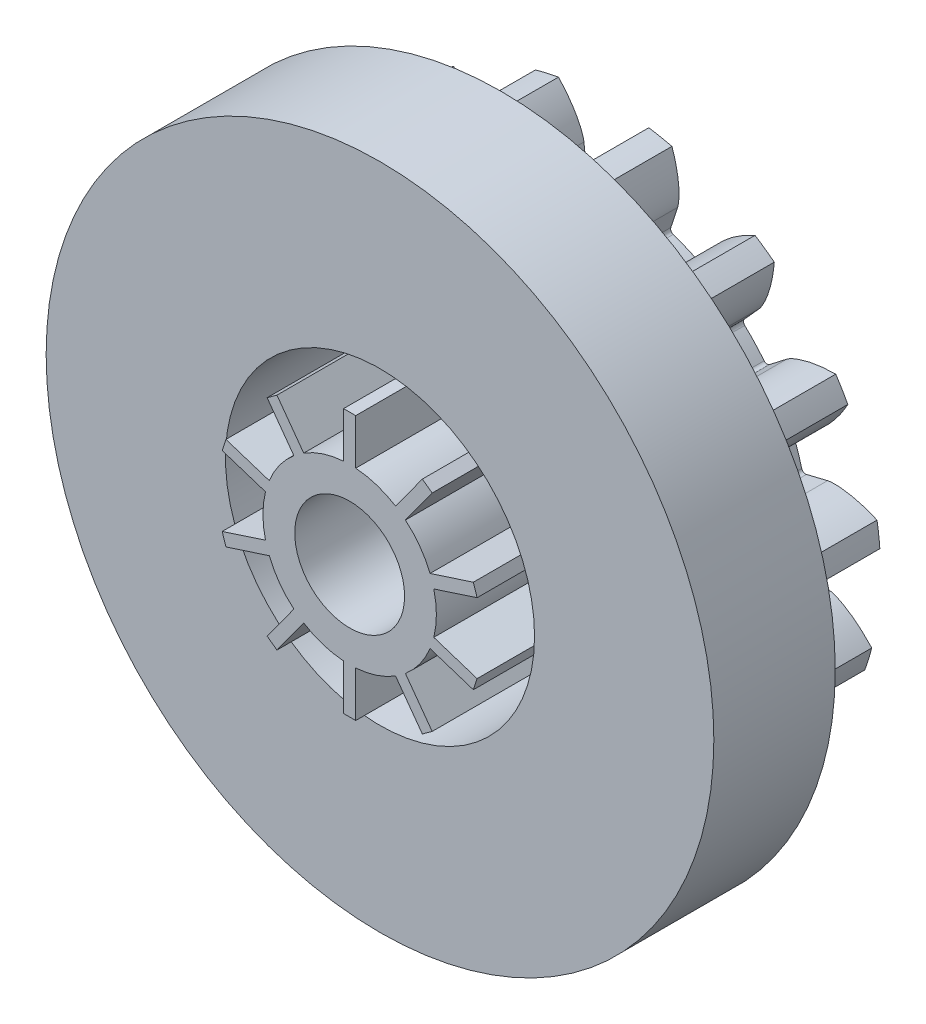
from build123d import *

# Parameters (mm, degrees)
SKETCH2_R                = 17.991666667
BOSS_EXTRUDE1_DEPTH      = 6
CUT_EXTRUDE1_DEPTH       = 6
FILLET1_R                = 0.254
CIRPATTERN3_COUNT        = 15
FILLET1_OF_CIRPATTERN3_R = 0.254
SKETCH3_R                = 17.991666667
BOSS_EXTRUDE2_DEPTH      = 1
SKETCH4_R                = 5.715
BOSS_EXTRUDE3_DEPTH      = 10
SKETCH5_R                = 3.6195
CUT_EXTRUDE2_DEPTH       = 31.60065603
SKETCH6_R                = 22
SKETCH6_R_2              = 10.184699829
BOSS_EXTRUDE4_DEPTH      = 8


# Read off the part's stored shape, not the designer's step: Cut-Extrude1
with BuildPart() as part:
    # Sketch2 → Boss-Extrude1 (new body)
    with BuildSketch(Plane.XY):
        Circle(SKETCH2_R)
    extrude(amount=BOSS_EXTRUDE1_DEPTH)

    # Cut-Extrude1 outline → Cut-Extrude1 (cut)
    with BuildSketch(Plane.XY):
        with BuildLine():
            add(Edge.make_bspline(
                [(17.405034837, -4.556844496), (17.338691355, -4.484278089), (17.194474578, -4.330614884), (16.972868305, -4.108341926), (16.699138419, -3.85718655), (16.447497308, -3.646349309), (16.232246792, -3.478953129), (16.05080163, -3.34681907), (15.864998696, -3.220553081), (15.674853543, -3.101130253), (15.480329647, -2.989260392), (15.29771766, -2.894691875), (15.128328526, -2.816354233), (14.98193445, -2.756834383), (14.866981202, -2.715793616), (14.775463249, -2.688070145), (14.718749461, -2.673483715), (14.688445491, -2.667246468), (14.677591871, -2.66527558)],
                knots=[0.499447972, 0.499447972, 0.499447972, 0.499447972, 0.499447972, 0.547323565, 0.602055884, 0.652783571, 0.680149903, 0.707515961, 0.734882063, 0.762248421, 0.789614741, 0.816980391, 0.844236067, 0.862480777, 0.880559096, 0.894007228, 0.903714168, 0.909090916, 0.909090916, 0.909090916, 0.909090916, 0.909090916], degree=4))
            ThreePointArc((17.405034837, -4.556844496), (17.91914784, -1.613756535), (17.9391376, 1.373831009))
            add(Edge.make_bspline(
                [(14.917620355, 0), (14.928651469, 0), (14.959582225, 0.000722592), (15.017989576, 0.004941481), (15.11298823, 0.015867702), (15.23342445, 0.035709845), (15.388097196, 0.068116321), (15.568757108, 0.114929364), (15.765327023, 0.175349646), (15.97670835, 0.250664633), (16.185130848, 0.334193391), (16.390503636, 0.425231009), (16.592637197, 0.522820865), (16.834332325, 0.64906559), (17.119593967, 0.811550625), (17.433792461, 1.009758546), (17.69154571, 1.188861507), (17.860896432, 1.314285557), (17.9391376, 1.373831009)],
                knots=[0, 0, 0, 0, 0, 0.005376748, 0.015083688, 0.02853182, 0.046610139, 0.064854849, 0.092110525, 0.119476175, 0.146842495, 0.174208853, 0.201574955, 0.228941013, 0.256307345, 0.307035032, 0.361767351, 0.409642944, 0.409642944, 0.409642944, 0.409642944, 0.409642944], degree=4))
            Line((14.917620355, 0), (13.229166667, 0))
            ThreePointArc((13.229166667, 0), (13.175844, -1.186585688), (13.016305852, -2.363605858))
            Line((13.016305852, -2.363605858), (14.677591871, -2.66527558))
        make_face()
    cut_extrude1 = extrude(amount=CUT_EXTRUDE1_DEPTH, mode=Mode.SUBTRACT)

    # Fillet1
    fillet1_edges = [part.edges().sort_by_distance(p)[0] for p in [
        (13.016305852, -2.363605858, 3),
        (13.229166667, 0, 3),
    ]]
    fillet(fillet1_edges, radius=FILLET1_R)

    # CirPattern3: Cut-Extrude1 ×15 about axis
    cirpattern3_axis = Axis((0, 0, 55), (0, 0, -1))
    for i in range(1, CIRPATTERN3_COUNT):
        add(cut_extrude1.rotate(cirpattern3_axis, i * 360 / CIRPATTERN3_COUNT), mode=Mode.SUBTRACT)

    # Fillet1 of CirPattern3
    fillet1_of_cirpattern3_edges = [part.edges().sort_by_distance(p)[0] for p in [
        (10.929621974, -7.453469943, 3),
        (12.085445117, -5.380786841, 3),
        (6.953107164, -11.254561362, 3),
        (8.852040314, -9.831186754, 3),
        (1.774336959, -13.109636877, 3),
        (4.088037322, -12.581685164, 3),
        (-3.711232226, -12.697937079, 3),
        (-1.382824462, -13.156695908, 3),
        (-8.555095644, -10.090648602, 3),
        (-6.614583333, -11.456794405, 3),
        (-11.919705304, -5.738595312, 3),
        (-10.702620655, -7.775909067, 3),
        (-13.22328963, -0.394286759, 3),
        (-12.940077635, -2.75049841, 3),
        (-12.240447049, 5.018197557, 3),
        (-12.940077635, 2.75049841, 3),
        (-9.141119973, 9.562989926, 3),
        (-10.702620655, 7.775909067, 3),
        (-4.461210208, 12.45425446, 3),
        (-6.614583334, 11.456794405, 3),
        (0.99008333, 13.192065255, 3),
        (-1.382824462, 13.156695908, 3),
        (6.270182465, 11.648848121, 3),
        (4.088037322, 12.581685164, 3),
        (10.46611009, 8.09143932, 3),
        (8.852040314, 9.831186754, 3),
        (12.852352199, 3.134947152, 3),
        (12.085445117, 5.380786841, 3),
    ]]
    fillet(fillet1_of_cirpattern3_edges, radius=FILLET1_OF_CIRPATTERN3_R)

    # Sketch3 → Boss-Extrude2 (add)
    with BuildSketch(Plane.XY.offset(6)):
        with Locations(Location((0, 0, 0), (0, 0, 177.328588329))):
            Circle(SKETCH3_R)
    extrude(amount=BOSS_EXTRUDE2_DEPTH)

    # Sketch4 → Boss-Extrude3 (add)
    with BuildSketch(Plane.XY.offset(7)):
        Circle(SKETCH4_R)
        with BuildLine():
            ThreePointArc((-3.674561448, 4.377079296), (-3.359192717, 4.623532123), (-3.027347853, 4.847307498))
            Line((-3.027347853, 4.847307498), (-4.790703609, 7.274358481))
            Line((-4.790703609, 7.274358481), (-5.437917205, 6.804130279))
            Line((-5.437917205, 6.804130279), (-3.674561448, 4.377079296))
        make_face()
        with BuildLine():
            ThreePointArc((-5.545565317, 1.381278508), (-5.435287991, 1.766032123), (-5.298351721, 2.142123721))
            Line((-5.298351721, 2.142123721), (-8.15152127, 3.069174705))
            Line((-8.15152127, 3.069174705), (-8.398734866, 2.308329492))
            Line((-8.398734866, 2.308329492), (-5.545565317, 1.381278508))
        make_face()
        with BuildLine():
            Line((0.4, 8.700984564), (-0.4, 8.700984564))
            Line((-0.4, 8.700984564), (-0.4, 5.700984564))
            ThreePointArc((-0.4, 5.700984564), (0, 5.715), (0.4, 5.700984564))
            Line((0.4, 5.700984564), (0.4, 8.700984564))
        make_face()
        with BuildLine():
            Line((4.790703609, 7.274358481), (3.027347853, 4.847307498))
            ThreePointArc((3.027347853, 4.847307498), (3.359192717, 4.623532123), (3.674561448, 4.377079296))
            Line((3.674561448, 4.377079296), (5.437917205, 6.804130279))
            Line((5.437917205, 6.804130279), (4.790703609, 7.274358481))
        make_face()
        with BuildLine():
            Line((8.15152127, 3.069174705), (5.298351721, 2.142123721))
            ThreePointArc((5.298351721, 2.142123721), (5.435287991, 1.766032123), (5.545565317, 1.381278508))
            Line((5.545565317, 1.381278508), (8.398734866, 2.308329492))
            Line((8.398734866, 2.308329492), (8.15152127, 3.069174705))
        make_face()
        with BuildLine():
            Line((8.398734866, -2.308329492), (5.545565317, -1.381278508))
            ThreePointArc((5.545565317, -1.381278508), (5.435287991, -1.766032123), (5.298351721, -2.142123721))
            Line((5.298351721, -2.142123721), (8.15152127, -3.069174705))
            Line((8.15152127, -3.069174705), (8.398734866, -2.308329492))
        make_face()
        with BuildLine():
            Line((5.437917205, -6.804130279), (3.674561448, -4.377079296))
            ThreePointArc((3.674561448, -4.377079296), (3.359192717, -4.623532123), (3.027347853, -4.847307498))
            Line((3.027347853, -4.847307498), (4.790703609, -7.274358481))
            Line((4.790703609, -7.274358481), (5.437917205, -6.804130279))
        make_face()
        with BuildLine():
            ThreePointArc((0.4, -5.700984564), (0, -5.715), (-0.4, -5.700984564))
            Line((-0.4, -5.700984564), (-0.4, -8.700984564))
            Line((-0.4, -8.700984564), (0.4, -8.700984564))
            Line((0.4, -8.700984564), (0.4, -5.700984564))
        make_face()
        with BuildLine():
            ThreePointArc((-3.027347853, -4.847307498), (-3.359192717, -4.623532123), (-3.674561448, -4.377079296))
            Line((-3.674561448, -4.377079296), (-5.437917205, -6.804130279))
            Line((-5.437917205, -6.804130279), (-4.790703609, -7.274358481))
            Line((-4.790703609, -7.274358481), (-3.027347853, -4.847307498))
        make_face()
        with BuildLine():
            ThreePointArc((-5.298351721, -2.142123721), (-5.435287991, -1.766032123), (-5.545565317, -1.381278508))
            Line((-5.545565317, -1.381278508), (-8.398734866, -2.308329492))
            Line((-8.398734866, -2.308329492), (-8.15152127, -3.069174705))
            Line((-8.15152127, -3.069174705), (-5.298351721, -2.142123721))
        make_face()
    extrude(amount=BOSS_EXTRUDE3_DEPTH)

    # Sketch5 → Cut-Extrude2 (cut, through all)
    with BuildSketch(Plane.XY.offset(17)):
        Circle(SKETCH5_R)
    extrude(amount=-CUT_EXTRUDE2_DEPTH, mode=Mode.SUBTRACT)

    # Sketch6 → Boss-Extrude4 (add)
    with BuildSketch(Plane.XY.offset(7)):
        Circle(SKETCH6_R)
        Circle(SKETCH6_R_2, mode=Mode.SUBTRACT)
    extrude(amount=BOSS_EXTRUDE4_DEPTH)


solid = part.part
